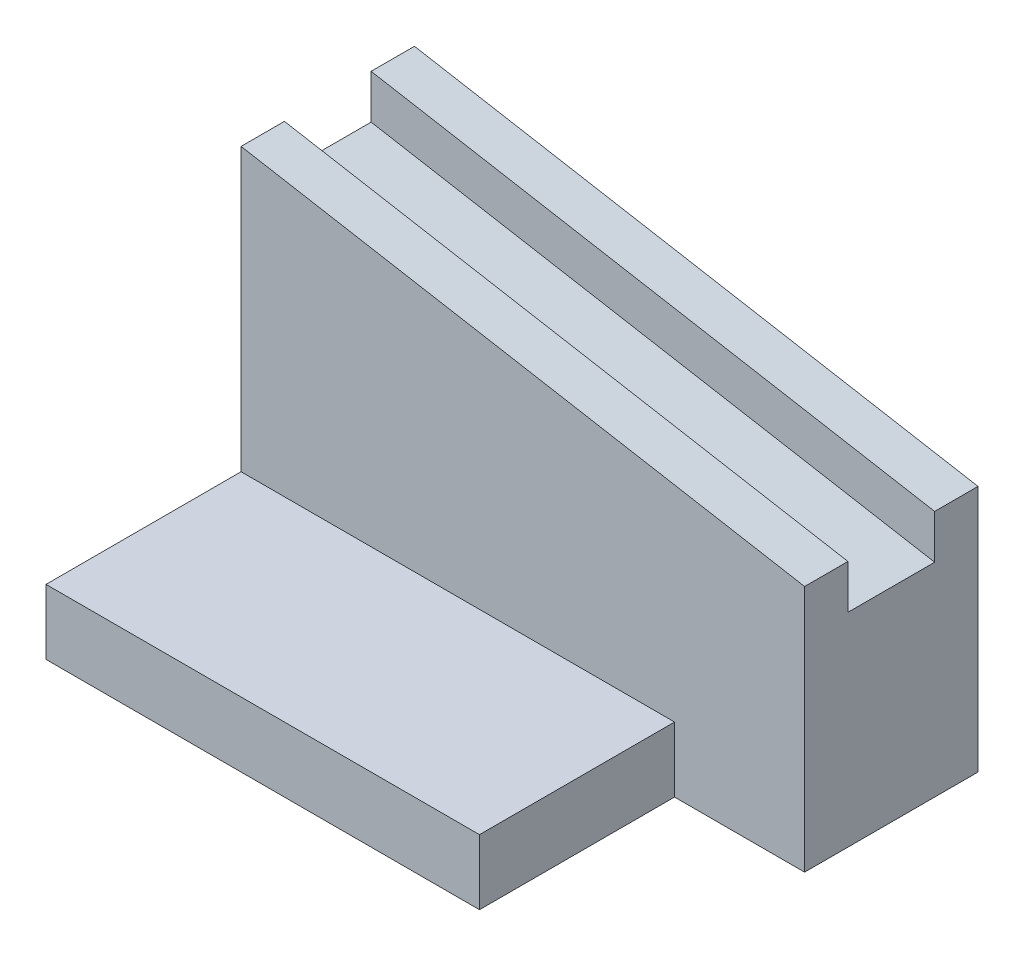
from build123d import *

# Parameters (mm, degrees)
RESSALTO_EXTRUS_O1_DEPTH = 40
ESBO_O4_W                = 171.630568717
ESBO_O4_H                = 20
CORTE_EXTRUS_O3_DEPTH    = 10
ESBO_O5_W                = 100
ESBO_O5_H                = 15
RESSALTO_EXTRUS_O2_DEPTH = 45


with BuildPart() as part:
    # Esboço1 → Ressalto-extrusão1 (new body)
    with BuildSketch(Plane.XY):
        Polygon((-53.29532416, 9.300830565), (76.70467584, 9.300830565), (76.70467584, 66.378323073), (-53.29532416, 89.300830565), align=None)
    extrude(amount=RESSALTO_EXTRUS_O1_DEPTH)

    # Esboço4 → Corte-extrusão3 (cut)
    with BuildSketch(Plane(origin=(13.664290772, 77.494043834, 0), x_dir=(0.9848077530122075, -0.17364817766693377, 0), z_dir=(0.1736481776669338, 0.9848077530122076, 0))):
        with Locations((8.431345703, -20)):
            Rectangle(ESBO_O4_W, ESBO_O4_H)
    extrude(amount=-CORTE_EXTRUS_O3_DEPTH, mode=Mode.SUBTRACT)

    # Esboço5 → Ressalto-extrusão2 (add)
    with BuildSketch(Plane.XY.offset(40)):
        with Locations((-3.29532416, 16.800830565)):
            Rectangle(ESBO_O5_W, ESBO_O5_H)
    extrude(amount=RESSALTO_EXTRUS_O2_DEPTH)


solid = part.part
